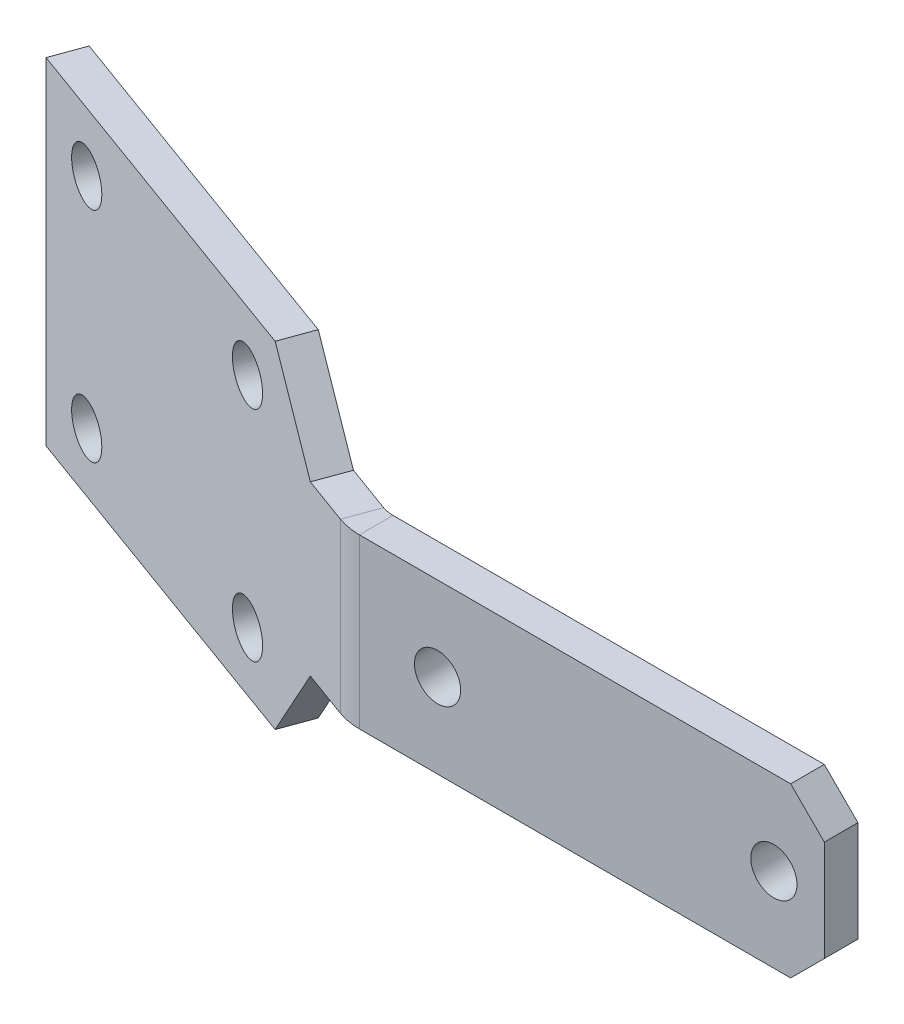
from build123d import *

# Parameters (mm, degrees)
SKETCH1_W                    = 88.9
SKETCH1_H                    = 31.75
BASE_FLANGE1_DEPTH           = 6.35
EDGE_FLANGE1_STRIP_CUT_DEPTH = 31.75
EDGE_FLANGE1_DEPTH           = 31.75
TAB1_DEPTH                   = 6.35
SKETCH12_R                   = 4.7625
CUT_EXTRUDE1_DEPTH           = 38.1
SKETCH13_R                   = 4.365625
CUT_EXTRUDE2_DEPTH           = 38.1
BREAK_CORNER1_START          = -6.35
BREAK_CORNER1_DEPTH          = 6.35


# Read off the part's stored shape, not the designer's step: Break-Corner1
# Sheet-metal steps are written as plain solids
with BuildPart() as part:
    # Sketch1 → Base-Flange1 (new body)
    with BuildSketch(Plane.XY):
        Rectangle(SKETCH1_W, SKETCH1_H)
    extrude(amount=-BASE_FLANGE1_DEPTH)

    # Edge-Flange1 strip (across the edge) → Edge-Flange1 strip cut (cut)
    with BuildSketch(Plane(origin=(-44.45, -15.875, -6.35), x_dir=(0.3420201433256631, 0, -0.9396926207859105), z_dir=(0, 1, 0))):
        Polygon((-18.615063745, 32.578309359), (-5.584096284, -3.223979493), (0.382951858, -1.052151583), (-12.648015603, 34.750137269), align=None)
    extrude(amount=EDGE_FLANGE1_STRIP_CUT_DEPTH, mode=Mode.SUBTRACT)

    # Edge-Flange1 section (across the edge) → Edge-Flange1 (add)
    with BuildSketch(Plane(origin=(-44.45, -15.875, -6.35), x_dir=(0.3420201433256631, 0, -0.9396926207859105), z_dir=(0, 1, 0))):
        with BuildLine():
            Line((-6.35, 1.119676327), (-6.35, 94.130323673))
            Line((-6.35, 94.130323673), (0, 94.130323673))
            Line((0, 94.130323673), (0, 1.119676327))
            ThreePointArc((0, 1.119676327), (0.096470768, 0.017010399), (0.382951858, -1.052151583))
            Line((0.382951858, -1.052151583), (-5.584096284, -3.223979493))
            ThreePointArc((-5.584096284, -3.223979493), (-6.157058463, -1.085655529), (-6.35, 1.119676327))
        make_face()
    extrude(amount=EDGE_FLANGE1_DEPTH)

    # Sketch9 → Tab1 (add)
    with BuildSketch(Plane(origin=(-3.158811591, 0, 8.678763518), x_dir=(-0.9396926207859105, 0, -0.342020143325663), z_dir=(0.342020143325663, 0, -0.9396926207859105))):
        Polygon((54.585841232, 15.875), (65.701635901, 31.75), (138.071488577, 31.75), (138.071488577, 15.875), align=None)
        Polygon((138.071488577, -31.75), (138.071488577, -15.875), (54.585841232, -15.875), (65.701635901, -31.75), align=None)
    extrude(amount=-TAB1_DEPTH)

    # Sketch12 → Cut-Extrude1 (cut)
    with BuildSketch(Plane(origin=(-3.158811591, 0, 8.678763518), x_dir=(-0.9396926207859104, 0, -0.34202014332566316), z_dir=(0.34202014332566316, 0, -0.9396926207859104))):
        with Locations((74.424778405, -20.6375)):
            Circle(SKETCH12_R)
        with Locations((125.224778405, -20.6375)):
            Circle(SKETCH12_R)
        with Locations((125.224778405, 20.6375)):
            Circle(SKETCH12_R)
        with Locations((74.424778405, 20.6375)):
            Circle(SKETCH12_R)
    extrude(amount=-CUT_EXTRUDE1_DEPTH, mode=Mode.SUBTRACT)

    # Sketch13 → Cut-Extrude2 (cut)
    with BuildSketch(Plane(origin=(0, 0, -6.35), x_dir=(-1, 0, 0), z_dir=(0, 0, -1))):
        with Locations((28.575, 0)):
            Circle(SKETCH13_R)
        with Locations((-34.925, 0)):
            Circle(SKETCH13_R)
    extrude(amount=-CUT_EXTRUDE2_DEPTH, mode=Mode.SUBTRACT)

    # Break-Corner1 outline → Break-Corner1 (cut)
    with BuildSketch(Plane.XY.offset(BREAK_CORNER1_START)):
        Polygon((44.45, -15.875), (44.45, -9.525), (38.1, -15.875), align=None)
        Polygon((38.1, 15.875), (44.45, 9.525), (44.45, 15.875), align=None)
    extrude(amount=BREAK_CORNER1_DEPTH, mode=Mode.SUBTRACT)


solid = part.part
